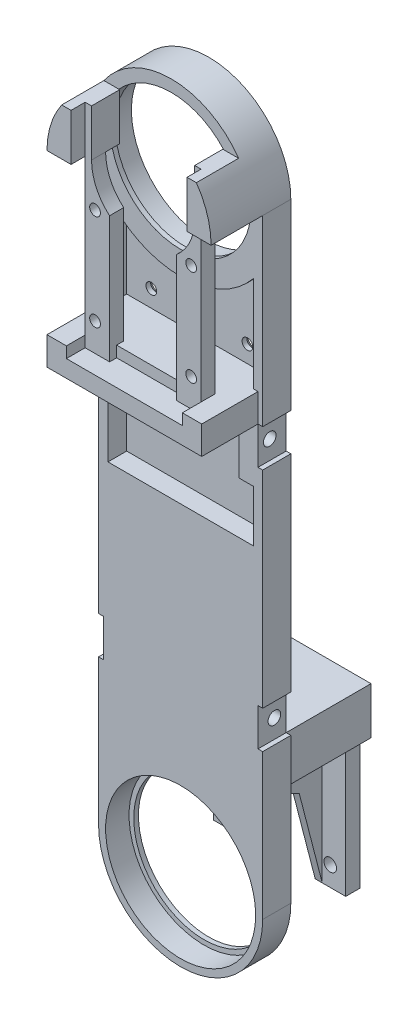
from build123d import *

# Parameters (mm, degrees)
EXTRUDE_1_DEPTH      = 6
SKETCH_2_R           = 16
CUT_EXTRUDE_1_DEPTH  = 5
CHAMFER_1_SIZE       = 0.5
CHAMFER_1_SIZE2      = 1.025151921
SKETCH_24_R          = 15
CUT_EXTRUDE_15_DEPTH = 149.618639477
CUT_EXTRUDE_16_DEPTH = 4
SKETCH_26_W          = 1
SKETCH_26_H          = 8
CUT_EXTRUDE_17_DEPTH = 149.655642342
SKETCH_27_R          = 1.35
CUT_EXTRUDE_18_DEPTH = 152.486798105
SKETCH_29_W          = 33
SKETCH_29_H          = 6
EXTRUDE_3_DEPTH      = 12
EXTRUDE_4_DEPTH      = 2
EXTRUDE_5_DEPTH      = 9
SKETCH_32_W          = 24.73
SKETCH_32_H          = 50
CUT_EXTRUDE_19_DEPTH = 4
SKETCH_33_W          = 14.3
SKETCH_33_H          = 2.35
CUT_EXTRUDE_20_DEPTH = 1.5
EXTRUDE_6_REACH      = 119.22
SKETCH_34_W          = 5.215
SKETCH_34_H          = 3
CUT_EXTRUDE_START    = -6
CUT_EXTRUDE_21_DEPTH = 6
SKETCH_36_R          = 1.15
CUT_EXTRUDE_22_DEPTH = 150.192828246
SKETCH_37_R          = 16
CUT_EXTRUDE_23_DEPTH = 5
SKETCH_38_R          = 15
CUT_EXTRUDE_24_DEPTH = 150.504180544
CUT_EXTRUDE_25_DEPTH = 4
SKETCH_40_W          = 33
SKETCH_40_H          = 10
EXTRUDE_7_DEPTH      = 22.1
SKETCH_41_W          = 15.2
SKETCH_41_H          = 3
CUT_EXTRUDE_26_DEPTH = 7.8
SKETCH_42_R          = 1.35
CUT_EXTRUDE_27_DEPTH = 8
SKETCH_43_W          = 6.5
SKETCH_43_H          = 3
EXTRUDE_8_DEPTH      = 29
CUT_EXTRUDE_28_REACH = 154.858
SKETCH_48_R          = 1.35
RIB_START            = -1.5
RIB_17_DEPTH         = 1.5
RIB_20_DEPTH         = 1.5
CHAMFER_2_SIZE       = 1


# Read off the part's stored shape, not the designer's step: 보강대17, 보강대20
with BuildPart() as part:
    # 스케치1 → 보스-돌출1 (new body)
    with BuildSketch(Plane.XY):
        with BuildLine():
            Line((-17.5, 0), (-17.5, 130))
            ThreePointArc((-17.5, 130), (0, 147.5), (17.5, 130))
            Line((17.5, 130), (17.5, 0))
            ThreePointArc((17.5, 0), (0, -17.5), (-17.5, 0))
        make_face()
    extrude(amount=EXTRUDE_1_DEPTH)

    # 스케치2 → 컷-돌출1 (cut)
    with BuildSketch(Plane(origin=(0, 0, 0), x_dir=(-1, 0, 0), z_dir=(0, 0, -1))):
        with Locations((0, 130)):
            Circle(SKETCH_2_R)
    extrude(amount=-CUT_EXTRUDE_1_DEPTH, mode=Mode.SUBTRACT)

    # 모따기1
    chamfer_1_edges = [part.edges().sort_by_distance(p)[0] for p in [
        (16, 130, 0),
    ]]
    chamfer_1_side = [part.faces().sort_by_distance(p)[0] for p in [
        (16, 130, 2.5),
    ]]
    chamfer(chamfer_1_edges, length=CHAMFER_1_SIZE, length2=CHAMFER_1_SIZE2, reference=chamfer_1_side[0])

    # 스케치24 → 컷-돌출15 (cut, through all)
    with BuildSketch(Plane(origin=(0, 0, 5), x_dir=(-1, 0, 0), z_dir=(0, 0, -1))):
        with Locations((0, 130)):
            Circle(SKETCH_24_R)
    extrude(amount=-CUT_EXTRUDE_15_DEPTH, mode=Mode.SUBTRACT)

    # 스케치25 → 컷-돌출16 (cut)
    with BuildSketch(Plane.XY.offset(6)):
        with BuildLine():
            Line((-15.5, 97), (15.5, 97))
            Line((15.5, 97), (15.5, 117.36077534))
            ThreePointArc((15.5, 117.36077534), (0, 110), (-15.5, 117.36077534))
            Line((-15.5, 117.36077534), (-15.5, 97))
        make_face()
        Polygon((-15.5, 79), (-12.5, 79), (-12.5, 91), (12.5, 91), (12.5, 79), (15.5, 79), (15.5, 68), (-15.5, 68), align=None)
    extrude(amount=-CUT_EXTRUDE_16_DEPTH, mode=Mode.SUBTRACT)

    # 스케치26 → 컷-돌출17 (cut, through all)
    with BuildSketch(Plane.XY.offset(6)):
        with Locations((-17, 87)):
            Rectangle(SKETCH_26_W, SKETCH_26_H)
        with Locations((17, 87)):
            Rectangle(SKETCH_26_W, SKETCH_26_H)
        with Locations((-17, 35)):
            Rectangle(SKETCH_26_W, SKETCH_26_H)
        with Locations((17, 35)):
            Rectangle(SKETCH_26_W, SKETCH_26_H)
    extrude(amount=-CUT_EXTRUDE_17_DEPTH, mode=Mode.SUBTRACT)

    # 스케치27 → 컷-돌출18 (cut, through all)
    with BuildSketch(Plane.ZY.offset(16.5)):
        with Locations((3.5, 87)):
            Circle(SKETCH_27_R)
        with Locations(Location((2.5, 35, 0), (0, 0, 270))):
            Circle(SKETCH_27_R)
    extrude(amount=-CUT_EXTRUDE_18_DEPTH, mode=Mode.SUBTRACT)

    # 스케치29 → 보스-돌출3 (add)
    with BuildSketch(Plane.XY.offset(6)):
        with Locations((0, 94)):
            Rectangle(SKETCH_29_W, SKETCH_29_H)
    extrude(amount=EXTRUDE_3_DEPTH)

    # 스케치30 → 보스-돌출4 (add)
    with BuildSketch(Plane.XY.offset(6)):
        with BuildLine():
            Line((-17.5, 130), (-15, 130))
            ThreePointArc((-15, 130), (0, 145), (15, 130))
            Line((15, 130), (17.5, 130))
            ThreePointArc((17.5, 130), (0, 147.5), (-17.5, 130))
        make_face()
    extrude(amount=EXTRUDE_4_DEPTH)

    # 스케치31 → 보스-돌출5 (add)
    with BuildSketch(Plane.XY.offset(8)):
        with BuildLine():
            Line((-17.5, 130), (-11, 130))
            ThreePointArc((-11, 130), (-9.257654472, 135.941029682), (-4.582575695, 140))
            Line((-4.582575695, 140), (-14.361406616, 140))
            ThreePointArc((-14.361406616, 140), (-16.696925103, 135.240485866), (-17.5, 130))
        make_face()
        with BuildLine():
            Line((11, 130), (17.5, 130))
            ThreePointArc((17.5, 130), (16.696925103, 135.240485866), (14.361406616, 140))
            Line((14.361406616, 140), (4.582575695, 140))
            ThreePointArc((4.582575695, 140), (9.257654472, 135.941029682), (11, 130))
        make_face()
    extrude(amount=EXTRUDE_5_DEPTH)

    # 스케치32 → 컷-돌출19 (cut)
    with BuildSketch(Plane.XY.offset(18)):
        with Locations((0, 119.65)):
            Rectangle(SKETCH_32_W, SKETCH_32_H)
    extrude(amount=-CUT_EXTRUDE_19_DEPTH, mode=Mode.SUBTRACT)

    # 스케치33 → 컷-돌출20 (cut)
    with BuildSketch(Plane.XY.offset(14)):
        with Locations((0, 95.825)):
            Rectangle(SKETCH_33_W, SKETCH_33_H)
    extrude(amount=-CUT_EXTRUDE_20_DEPTH, mode=Mode.SUBTRACT)

    # 스케치34 → 보스-돌출6 (add, up to next)
    with BuildSketch(Plane(origin=(0, 97, 0), x_dir=(1, 0, 0), z_dir=(0, 1, 0)), mode=Mode.PRIVATE) as extrude_6_sk1:
        with Locations((-9.7575, -12.5)):
            Rectangle(SKETCH_34_W, SKETCH_34_H)
    extrude_6_tool1 = extrude(extrude_6_sk1.sketch, amount=EXTRUDE_6_REACH, mode=Mode.PRIVATE) - part.part
    # 스케치34 → 보스-돌출6 (add, up to next)
    with BuildSketch(Plane(origin=(0, 97, 0), x_dir=(1, 0, 0), z_dir=(0, 1, 0)), mode=Mode.PRIVATE) as extrude_6_sk2:
        with Locations((9.7575, -12.5)):
            Rectangle(SKETCH_34_W, SKETCH_34_H)
    extrude_6_tool2 = extrude(extrude_6_sk2.sketch, amount=EXTRUDE_6_REACH, mode=Mode.PRIVATE) - part.part
    add(extrude_6_tool1.solids().sort_by_distance((-9.7575, 97, 12.5))[0])
    add(extrude_6_tool2.solids().sort_by_distance((9.7575, 97, 12.5))[0])

    # 스케치35 → 컷-돌출21 (cut)
    with BuildSketch(Plane.XY.offset(14).offset(CUT_EXTRUDE_START)):
        with BuildLine():
            Line((-11, 130), (-11, 140))
            Line((-11, 140), (11, 140))
            Line((11, 140), (11, 130))
            ThreePointArc((11, 130), (0, 119), (-11, 130))
        make_face()
    extrude(amount=CUT_EXTRUDE_21_DEPTH, mode=Mode.SUBTRACT)

    # 스케치36 → 컷-돌출22 (cut, through all)
    with BuildSketch(Plane.XY.offset(14)):
        with Locations((-10.25, 121.15)):
            Circle(SKETCH_36_R)
        with Locations((10.25, 121.15)):
            Circle(SKETCH_36_R)
        with Locations((-10.25, 100.65)):
            Circle(SKETCH_36_R)
        with Locations((10.25, 100.65)):
            Circle(SKETCH_36_R)
    extrude(amount=-CUT_EXTRUDE_22_DEPTH, mode=Mode.SUBTRACT)

    # 스케치37 → 컷-돌출23 (cut)
    with BuildSketch(Plane.XY.offset(6)):
        Circle(SKETCH_37_R)
    extrude(amount=-CUT_EXTRUDE_23_DEPTH, mode=Mode.SUBTRACT)

    # 스케치38 → 컷-돌출24 (cut, through all)
    with BuildSketch(Plane.XY.offset(1)):
        Circle(SKETCH_38_R)
    extrude(amount=-CUT_EXTRUDE_24_DEPTH, mode=Mode.SUBTRACT)

    # 스케치39 → 컷-돌출25 (cut)
    with BuildSketch(Plane(origin=(0, 0, 0), x_dir=(-1, 0, 0), z_dir=(0, 0, -1))):
        with BuildLine():
            Line((-15.5, 58), (-15.5, 41))
            Line((-15.5, 41), (-13.5, 41))
            Line((-13.5, 41), (-13.5, 29))
            Line((-13.5, 29), (-15.5, 29))
            Line((-15.5, 29), (-15.5, 12.63922466))
            ThreePointArc((-15.5, 12.63922466), (0, 20), (15.5, 12.63922466))
            Line((15.5, 12.63922466), (15.5, 29))
            Line((15.5, 29), (13.5, 29))
            Line((13.5, 29), (13.5, 41))
            Line((13.5, 41), (15.5, 41))
            Line((15.5, 41), (15.5, 58))
            Line((15.5, 58), (-15.5, 58))
        make_face()
    extrude(amount=-CUT_EXTRUDE_25_DEPTH, mode=Mode.SUBTRACT)

    # 스케치40 → 보스-돌출7 (add)
    with BuildSketch(Plane(origin=(0, 0, 4), x_dir=(-1, 0, 0), z_dir=(0, 0, -1))):
        with Locations((0, 26)):
            Rectangle(SKETCH_40_W, SKETCH_40_H)
    extrude(amount=EXTRUDE_7_DEPTH)

    # 스케치41 → 컷-돌출26 (cut)
    with BuildSketch(Plane(origin=(0, 0, -18.1), x_dir=(-1, 0, 0), z_dir=(0, 0, -1))):
        with Locations((0, 22.5)):
            Rectangle(SKETCH_41_W, SKETCH_41_H)
    extrude(amount=-CUT_EXTRUDE_26_DEPTH, mode=Mode.SUBTRACT)

    # 스케치42 → 컷-돌출27 (cut)
    with BuildSketch(Plane(origin=(0, 0, -18.1), x_dir=(-1, 0, 0), z_dir=(0, 0, -1))):
        with Locations((-3.75, 27.33)):
            Circle(SKETCH_42_R)
        with Locations((3.75, 27.33)):
            Circle(SKETCH_42_R)
    extrude(amount=-CUT_EXTRUDE_27_DEPTH, mode=Mode.SUBTRACT)

    # 스케치43 → 보스-돌출8 (add)
    with BuildSketch(Plane.XZ.offset(-21)):
        with Locations((-10.85, -16.6)):
            Rectangle(SKETCH_43_W, SKETCH_43_H)
        with Locations((10.85, -16.6)):
            Rectangle(SKETCH_43_W, SKETCH_43_H)
    extrude(amount=EXTRUDE_8_DEPTH)

    # 스케치48 → 컷-돌출28 (cut, up to next)
    with BuildSketch(Plane(origin=(0, 0, -18.1), x_dir=(-1, 0, 0), z_dir=(0, 0, -1)), mode=Mode.PRIVATE) as cut_extrude_28_sk1:
        with Locations((10.8, -3.8)):
            Circle(SKETCH_48_R)
    cut_extrude_28_tool1 = extrude(cut_extrude_28_sk1.sketch, amount=-CUT_EXTRUDE_28_REACH, mode=Mode.PRIVATE) & part.part
    # 스케치48 → 컷-돌출28 (cut, up to next)
    with BuildSketch(Plane(origin=(0, 0, -18.1), x_dir=(-1, 0, 0), z_dir=(0, 0, -1)), mode=Mode.PRIVATE) as cut_extrude_28_sk2:
        with Locations((-10.8, -3.8)):
            Circle(SKETCH_48_R)
    cut_extrude_28_tool2 = extrude(cut_extrude_28_sk2.sketch, amount=-CUT_EXTRUDE_28_REACH, mode=Mode.PRIVATE) & part.part
    add(cut_extrude_28_tool1.solids().sort_by_distance((-10.8, -3.8, -18.1))[0], mode=Mode.SUBTRACT)
    add(cut_extrude_28_tool2.solids().sort_by_distance((10.8, -3.8, -18.1))[0], mode=Mode.SUBTRACT)

    # 보강대17 outline → 보강대17 (add)
    with BuildSketch(Plane(origin=(-7.6, 0, 0), x_dir=(0, 0, -1), z_dir=(1, 0, 0)).offset(RIB_START)):
        Polygon((15.1, -8), (15.1, 22), (-6, 22), (-6, 19.000000001), (-4, 18.011504048), (-3.591955232, 17.809828747), (0, 16.034512143), (10.186206897, 11), align=None)
    extrude(amount=RIB_17_DEPTH)

    # 보강대20 outline → 보강대20 (add)
    with BuildSketch(Plane.ZY.offset(-7.6).offset(RIB_START)):
        Polygon((-15.1, -8), (-10.186206897, 11), (0, 16.034512143), (3.591955232, 17.809828747), (4, 18.011504048), (4, 22), (-15.1, 22), align=None)
    extrude(amount=RIB_20_DEPTH)

    # 모따기2
    chamfer_2_edges = [part.edges().sort_by_distance(p)[0] for p in [
        (-11.4, 100.65, 0),
        (9.1, 100.65, 0),
    ]]
    chamfer(chamfer_2_edges, length=CHAMFER_2_SIZE)


solid = part.part
